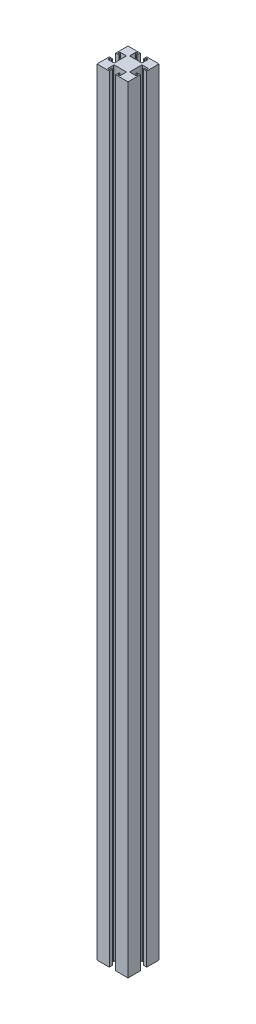
from build123d import *

# Parameters (mm, degrees)
RESSALTO_EXTRUS_O1_DEPTH = 1000


with BuildPart() as part:
    # Esboço2 → Ressalto-extrusão1 (new body)
    with BuildSketch(Plane(origin=(0, 0, 0), x_dir=(1, 0, 0), z_dir=(0, 1, 0))):
        with BuildLine():
            Line((-1.803730261, 22.417940287), (-1.803730261, 6.567940287))
            Line((-1.803730261, 6.567940287), (2.696269739, 6.567940287))
            Line((2.696269739, 6.567940287), (2.696269739, 7.917940287))
            Line((2.696269739, 7.917940287), (-0.281184469, 7.917940287))
            Line((-0.281184469, 7.917940287), (-0.281184469, 9.417940287))
            ThreePointArc((-0.281184469, 9.417940287), (0.01170875, 10.125047068), (0.718815531, 10.417940287))
            Line((0.718815531, 10.417940287), (2.218815531, 10.417940287))
            Line((2.218815531, 10.417940287), (7.218815531, 10.417940287))
            ThreePointArc((7.218815531, 10.417940287), (7.925922312, 10.125047068), (8.218815531, 9.417940287))
            Line((8.218815531, 9.417940287), (8.218815531, -4.582059713))
            ThreePointArc((8.218815531, -4.582059713), (7.925922312, -5.289166494), (7.218815531, -5.582059713))
            Line((7.218815531, -5.582059713), (2.218815531, -5.582059713))
            Line((2.218815531, -5.582059713), (0.718815531, -5.582059713))
            ThreePointArc((0.718815531, -5.582059713), (0.01170875, -5.289166494), (-0.281184469, -4.582059713))
            Line((-0.281184469, -4.582059713), (-0.281184469, -3.082059713))
            Line((-0.281184469, -3.082059713), (2.696269739, -3.082059713))
            Line((2.696269739, -3.082059713), (2.696269739, -1.732059713))
            Line((2.696269739, -1.732059713), (-1.803730261, -1.732059713))
            Line((-1.803730261, -1.732059713), (-1.803730261, -17.582059713))
            Line((-1.803730261, -17.582059713), (14.046269739, -17.582059713))
            Line((14.046269739, -17.582059713), (14.046269739, -13.082059713))
            Line((14.046269739, -13.082059713), (12.696269739, -13.082059713))
            Line((12.696269739, -13.082059713), (12.696269739, -16.059513921))
            Line((12.696269739, -16.059513921), (11.196269739, -16.059513921))
            ThreePointArc((11.196269739, -16.059513921), (10.489162958, -15.766620702), (10.196269739, -15.059513921))
            Line((10.196269739, -15.059513921), (10.196269739, -13.559513921))
            Line((10.196269739, -13.559513921), (10.196269739, -8.559513921))
            ThreePointArc((10.196269739, -8.559513921), (10.489162958, -7.85240714), (11.196269739, -7.559513921))
            Line((11.196269739, -7.559513921), (25.196269739, -7.559513921))
            ThreePointArc((25.196269739, -7.559513921), (25.90337652, -7.85240714), (26.196269739, -8.559513921))
            Line((26.196269739, -8.559513921), (26.196269739, -13.559513921))
            Line((26.196269739, -13.559513921), (26.196269739, -15.059513921))
            ThreePointArc((26.196269739, -15.059513921), (25.90337652, -15.766620702), (25.196269739, -16.059513921))
            Line((25.196269739, -16.059513921), (23.696269739, -16.059513921))
            Line((23.696269739, -16.059513921), (23.696269739, -13.082059713))
            Line((23.696269739, -13.082059713), (22.346269739, -13.082059713))
            Line((22.346269739, -13.082059713), (22.346269739, -17.582059713))
            Line((22.346269739, -17.582059713), (38.196269739, -17.582059713))
            Line((38.196269739, -17.582059713), (38.196269739, -1.732059713))
            Line((38.196269739, -1.732059713), (33.696269739, -1.732059713))
            Line((33.696269739, -1.732059713), (33.696269739, -3.082059713))
            Line((33.696269739, -3.082059713), (36.673723947, -3.082059713))
            Line((36.673723947, -3.082059713), (36.673723947, -4.582059713))
            ThreePointArc((36.673723947, -4.582059713), (36.380830728, -5.289166494), (35.673723947, -5.582059713))
            Line((35.673723947, -5.582059713), (34.173723947, -5.582059713))
            Line((34.173723947, -5.582059713), (29.173723947, -5.582059713))
            ThreePointArc((29.173723947, -5.582059713), (28.466617166, -5.289166494), (28.173723947, -4.582059713))
            Line((28.173723947, -4.582059713), (28.173723947, 9.417940287))
            ThreePointArc((28.173723947, 9.417940287), (28.466617166, 10.125047068), (29.173723947, 10.417940287))
            Line((29.173723947, 10.417940287), (34.173723947, 10.417940287))
            Line((34.173723947, 10.417940287), (35.673723947, 10.417940287))
            ThreePointArc((35.673723947, 10.417940287), (36.380830728, 10.125047068), (36.673723947, 9.417940287))
            Line((36.673723947, 9.417940287), (36.673723947, 7.917940287))
            Line((36.673723947, 7.917940287), (33.696269739, 7.917940287))
            Line((33.696269739, 7.917940287), (33.696269739, 6.567940287))
            Line((33.696269739, 6.567940287), (38.196269739, 6.567940287))
            Line((38.196269739, 6.567940287), (38.196269739, 22.417940287))
            Line((38.196269739, 22.417940287), (22.346269739, 22.417940287))
            Line((22.346269739, 22.417940287), (22.346269739, 17.917940287))
            Line((22.346269739, 17.917940287), (23.696269739, 17.917940287))
            Line((23.696269739, 17.917940287), (23.696269739, 20.895394495))
            Line((23.696269739, 20.895394495), (25.196269739, 20.895394495))
            ThreePointArc((25.196269739, 20.895394495), (25.90337652, 20.602501277), (26.196269739, 19.895394495))
            Line((26.196269739, 19.895394495), (26.196269739, 18.395394495))
            Line((26.196269739, 18.395394495), (26.196269739, 13.395394495))
            ThreePointArc((26.196269739, 13.395394495), (25.90337652, 12.688287714), (25.196269739, 12.395394495))
            Line((25.196269739, 12.395394495), (11.196269739, 12.395394495))
            ThreePointArc((11.196269739, 12.395394495), (10.489162958, 12.688287714), (10.196269739, 13.395394495))
            Line((10.196269739, 13.395394495), (10.196269739, 18.395394495))
            Line((10.196269739, 18.395394495), (10.196269739, 19.895394495))
            ThreePointArc((10.196269739, 19.895394495), (10.489162958, 20.602501277), (11.196269739, 20.895394495))
            Line((11.196269739, 20.895394495), (12.696269739, 20.895394495))
            Line((12.696269739, 20.895394495), (12.696269739, 17.917940287))
            Line((12.696269739, 17.917940287), (14.046269739, 17.917940287))
            Line((14.046269739, 17.917940287), (14.046269739, 22.417940287))
            Line((14.046269739, 22.417940287), (-1.803730261, 22.417940287))
        make_face()
    extrude(amount=RESSALTO_EXTRUS_O1_DEPTH)


solid = part.part
